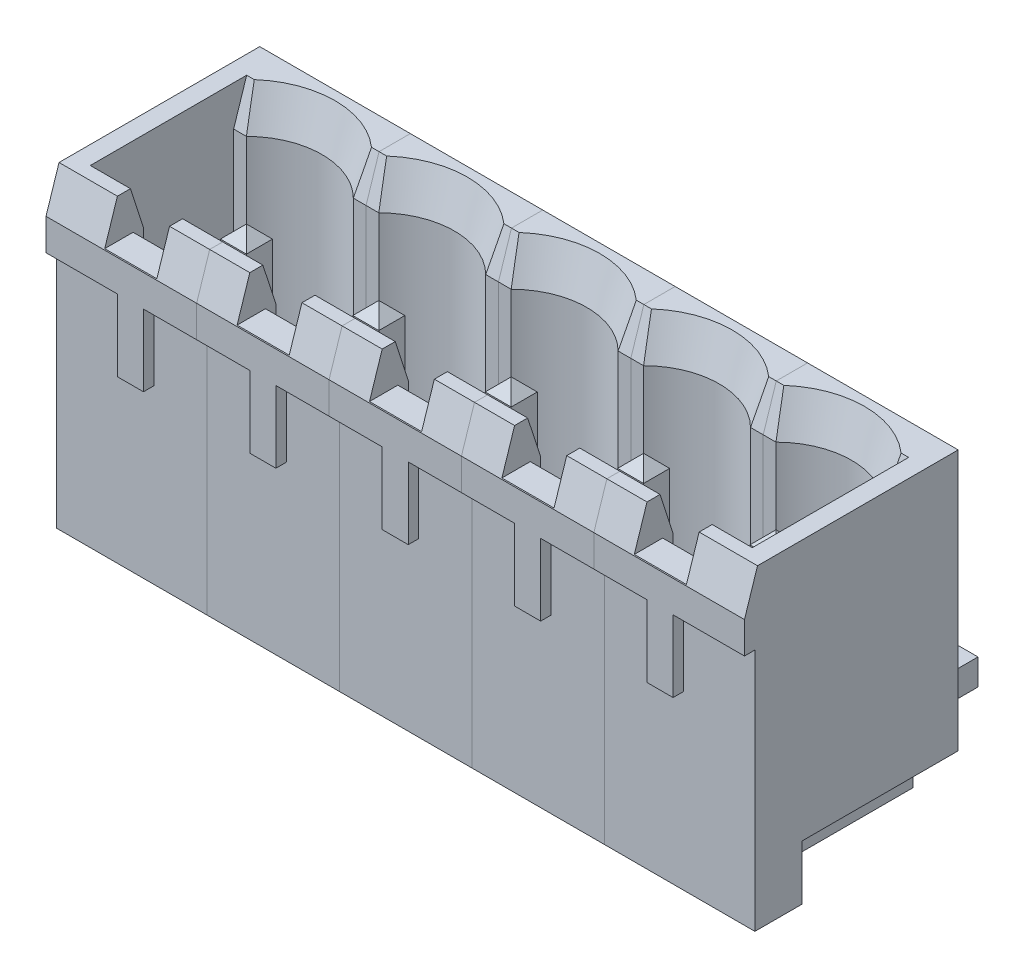
from build123d import *
from OCP.BRepFilletAPI import BRepFilletAPI_MakeChamfer

# Parameters (mm, degrees)
SKETCH_1_W             = 5.08
SKETCH_1_H             = 12.1
EXTRUDE_1_DEPTH        = 8.2
CUT_EXTRUDE_1_DEPTH    = 8.7
SKETCH_3_R             = 1.2
EXTRUDE_2_DEPTH        = 2
FILLET_1_R             = 0.25
CHAMFER_1_SIZE         = 0.5
CHAMFER_1_SIZE2        = 1.538841769
SKETCH_4_W             = 2
SKETCH_4_H             = 1.010953213
CUT_EXTRUDE_2_DEPTH    = 4.75
SKETCH_5_W             = 2
SKETCH_5_H             = 1.705458635
CUT_EXTRUDE_3_DEPTH    = 1.5
CHAMFER_2_SIZE         = 0.5
CHAMFER_2_SIZE2        = 1.538841769
SKETCH_6_W             = 5.08
SKETCH_6_H             = 6.6
CUT_EXTRUDE_4_DEPTH    = 0.4
SKETCH_7_W             = 2.04
SKETCH_7_H             = 2.75
CUT_EXTRUDE_5_DEPTH    = 0.4
EXTRUDE_1_2_DEPTH      = 0.5
EXTRUDE_1_2_DEPTH_BACK = 0.5
CHAMFER_3_SIZE         = 0.5
SKETCH_9_W             = 1
SKETCH_9_H             = 2.1
SKETCH_9_W_2           = 1.04
CUT_EXTRUDE_6_DEPTH    = 6
PATTERN_LINEAR_1_COUNT = 5
PATTERN_LINEAR_1_PITCH = 5.08
MOVE_BODY_1_ANGLE      = 180
EXTRUDE_3_DEPTH        = 0.7
EXTRUDE_4_DEPTH        = 0.7


with BuildPart() as part:
    # Эскиз1 → Extrude 1 (new body)
    with BuildSketch(Plane(origin=(0, 0, 0), x_dir=(1, 0, 0), z_dir=(0, 1, 0))):
        Rectangle(SKETCH_1_W, SKETCH_1_H)
    extrude(amount=EXTRUDE_1_DEPTH)

    # Эскиз2 → Вырез-Вытянуть1 (cut)
    with BuildSketch(Plane.XY.offset(6.05)):
        with BuildLine():
            Line((-2.54, 6.7), (2.54, 6.7))
            Line((2.54, 6.7), (2.54, 1.7))
            Line((2.54, 1.7), (2.05121915, 1.7))
            ThreePointArc((2.05121915, 1.7), (0, 0.85), (-2.05121915, 1.7))
            Line((-2.05121915, 1.7), (-2.54, 1.7))
            Line((-2.54, 1.7), (-2.54, 6.7))
        make_face()
    extrude(amount=-CUT_EXTRUDE_1_DEPTH, mode=Mode.SUBTRACT)

    # Эскиз3 → Бобышка-Вытянуть2 (add)
    with BuildSketch(Plane.XY.offset(-2.65)):
        with Locations((0, 3.75)):
            Circle(SKETCH_3_R)
    extrude(amount=EXTRUDE_2_DEPTH)

    # Скругление1
    fillet_1_edges = [part.edges().sort_by_distance(p)[0] for p in [
        (-1.2, 3.75, -0.65),
    ]]
    fillet(fillet_1_edges, radius=FILLET_1_R)

    # Фаска1: one chamfer whose edges measure the first distance from different faces: ONE call of the kernel's chamfer builder (chamfer() names one face for all edges)
    chamfer_1_edges_1 = [part.edges().sort_by_distance(p)[0] for p in [
        (0, 6.7, 6.05),
    ]]
    chamfer_1_side_1 = [part.faces().sort_by_distance(p)[0] for p in [
        (0, 7.45, 6.05),
    ]]
    chamfer_1_edges_2 = [part.edges().sort_by_distance(p)[0] for p in [
        (2.295609575, 1.7, 6.05),
        (-2.295609575, 1.7, 6.05),
        (0, 0.85, 6.05),
    ]]
    chamfer_1_side_2 = [part.faces().sort_by_distance(p)[0] for p in [
        (0, 0.655214235, 6.05),
    ]]
    chamfer_1 = BRepFilletAPI_MakeChamfer(part.part.solid().wrapped)
    for e in chamfer_1_edges_1:
        chamfer_1.Add(CHAMFER_1_SIZE, CHAMFER_1_SIZE2, e.wrapped, chamfer_1_side_1[0].wrapped)  # the first distance lies on this face
    for e in chamfer_1_edges_2:
        chamfer_1.Add(CHAMFER_1_SIZE, CHAMFER_1_SIZE2, e.wrapped, chamfer_1_side_2[0].wrapped)  # the first distance lies on this face
    add(Compound.cast(chamfer_1.Shape()), mode=Mode.REPLACE)

    # Эскиз4 → Вырез-Вытянуть2 (cut)
    with BuildSketch(Plane.XY.offset(6.05)):
        with Locations((0, 6.594523394)):
            Rectangle(SKETCH_4_W, SKETCH_4_H)
    extrude(amount=-CUT_EXTRUDE_2_DEPTH, mode=Mode.SUBTRACT)

    # Эскиз5 → Вырез-Вытянуть3 (cut)
    with BuildSketch(Plane.XY.offset(6.05)):
        with Locations((0, 7.552729318)):
            Rectangle(SKETCH_5_W, SKETCH_5_H)
    extrude(amount=-CUT_EXTRUDE_3_DEPTH, mode=Mode.SUBTRACT)

    # Фаска2
    chamfer_2_edges = [part.edges().sort_by_distance(p)[0] for p in [
        (-1.77, 8.2, 6.05),
    ]]
    chamfer_2_side = [part.faces().sort_by_distance(p)[0] for p in [
        (-1.77, 7.7, 6.05),
    ]]
    chamfer(chamfer_2_edges, length=CHAMFER_2_SIZE, length2=CHAMFER_2_SIZE2, reference=chamfer_2_side[0])

    # Эскиз6 → Вырез-Вытянуть4 (cut)
    with BuildSketch(Plane(origin=(0, 8.2, 0), x_dir=(1, 0, 0), z_dir=(0, 1, 0))):
        with Locations((0, 2.75)):
            Rectangle(SKETCH_6_W, SKETCH_6_H)
    extrude(amount=-CUT_EXTRUDE_4_DEPTH, mode=Mode.SUBTRACT)

    # Эскиз7 → Вырез-Вытянуть5 (cut)
    with BuildSketch(Plane(origin=(0, 8.2, 0), x_dir=(1, 0, 0), z_dir=(0, 1, 0))):
        with Locations((1.52, -1.925)):
            Rectangle(SKETCH_7_W, SKETCH_7_H)
        with Locations((-1.52, -1.925)):
            Rectangle(SKETCH_7_W, SKETCH_7_H)
    extrude(amount=-CUT_EXTRUDE_5_DEPTH, mode=Mode.SUBTRACT)

    # Эскиз9 → Вырез-Вытянуть6 (cut)
    with BuildSketch(Plane.XZ):
        with Locations((0, -5)):
            Rectangle(SKETCH_9_W, SKETCH_9_H)
        with Locations((-2.02, -5)):
            Rectangle(SKETCH_9_W_2, SKETCH_9_H)
        with Locations((2.02, -5)):
            Rectangle(SKETCH_9_W_2, SKETCH_9_H)
    extrude(amount=-CUT_EXTRUDE_6_DEPTH, mode=Mode.SUBTRACT)


with BuildPart() as body_2:
    # Эскиз8 → Extrude 1 2 (new, two sides: drawn at the far end of the back side and taken through both)
    with BuildSketch(Plane(origin=(0, 0, 0), x_dir=(0, 0, -1), z_dir=(1, 0, 0)).offset(-EXTRUDE_1_2_DEPTH_BACK)):
        with BuildLine():
            Line((-3.65, 3.25), (3.95, 3.25))
            Line((3.95, 3.25), (3.95, -4))
            Line((3.95, -4), (4.95, -4))
            Line((4.95, -4), (4.95, 3.25))
            ThreePointArc((4.95, 3.25), (4.657106781, 3.957106781), (3.95, 4.25))
            Line((3.95, 4.25), (-3.65, 4.25))
            Line((-3.65, 4.25), (-3.65, 3.25))
        make_face()
    extrude(amount=EXTRUDE_1_2_DEPTH + EXTRUDE_1_2_DEPTH_BACK)

    # Фаска3
    chamfer_3_edges = [body_2.edges().sort_by_distance(p)[0] for p in [
        (0, 3.25, 3.65),
        (0, 4.25, 3.65),
        (0, -4, -4.95),
        (0, -4, -3.95),
        (0.5, -4, -4.45),
        (0.5, 3.75, 3.65),
        (-0.5, 3.75, 3.65),
        (-0.5, -4, -4.45),
    ]]
    chamfer(chamfer_3_edges, length=CHAMFER_3_SIZE - 0.0001)  # a hair under: the kernel refuses the full size


with BuildPart() as pattern_linear_1_1:
    # Линейный массив1: pattern copy
    add(part.part.moved(Location(Vector(-1, 0, 0) * (1 * PATTERN_LINEAR_1_PITCH))))


with BuildPart() as pattern_linear_1_2:
    # Линейный массив1: pattern copy
    add(part.part.moved(Location(Vector(-1, 0, 0) * (2 * PATTERN_LINEAR_1_PITCH))))


with BuildPart() as pattern_linear_1_3:
    # Линейный массив1: pattern copy
    add(part.part.moved(Location(Vector(-1, 0, 0) * (3 * PATTERN_LINEAR_1_PITCH))))


with BuildPart() as pattern_linear_1_4:
    # Линейный массив1: pattern copy
    add(part.part.moved(Location(Vector(-1, 0, 0) * (4 * PATTERN_LINEAR_1_PITCH))))


with BuildPart() as pattern_linear_1_5:
    # Линейный массив1: pattern copy
    add(body_2.part.moved(Location(Vector(-1, 0, 0) * (1 * PATTERN_LINEAR_1_PITCH))))


with BuildPart() as pattern_linear_1_6:
    # Линейный массив1: pattern copy
    add(body_2.part.moved(Location(Vector(-1, 0, 0) * (2 * PATTERN_LINEAR_1_PITCH))))


with BuildPart() as pattern_linear_1_7:
    # Линейный массив1: pattern copy
    add(body_2.part.moved(Location(Vector(-1, 0, 0) * (3 * PATTERN_LINEAR_1_PITCH))))


with BuildPart() as pattern_linear_1_8:
    # Линейный массив1: pattern copy
    add(body_2.part.moved(Location(Vector(-1, 0, 0) * (4 * PATTERN_LINEAR_1_PITCH))))


with BuildPart() as body_2_1:
    # Move Body 1: moved
    add(body_2.part.rotate(Axis((0, 0, 0), (0, 0.7071067811865488, 0.7071067811865462)), MOVE_BODY_1_ANGLE))


with BuildPart() as part_1:
    # Move Body 1: moved
    add(part.part.rotate(Axis((0, 0, 0), (0, 0.7071067811865488, 0.7071067811865462)), MOVE_BODY_1_ANGLE))


with BuildPart() as pattern_linear_1_5_1:
    # Move Body 1: moved
    add(pattern_linear_1_5.part.rotate(Axis((0, 0, 0), (0, 0.7071067811865488, 0.7071067811865462)), MOVE_BODY_1_ANGLE))


with BuildPart() as pattern_linear_1_1_1:
    # Move Body 1: moved
    add(pattern_linear_1_1.part.rotate(Axis((0, 0, 0), (0, 0.7071067811865488, 0.7071067811865462)), MOVE_BODY_1_ANGLE))


with BuildPart() as pattern_linear_1_2_1:
    # Move Body 1: moved
    add(pattern_linear_1_2.part.rotate(Axis((0, 0, 0), (0, 0.7071067811865488, 0.7071067811865462)), MOVE_BODY_1_ANGLE))


with BuildPart() as pattern_linear_1_6_1:
    # Move Body 1: moved
    add(pattern_linear_1_6.part.rotate(Axis((0, 0, 0), (0, 0.7071067811865488, 0.7071067811865462)), MOVE_BODY_1_ANGLE))


with BuildPart() as pattern_linear_1_3_1:
    # Move Body 1: moved
    add(pattern_linear_1_3.part.rotate(Axis((0, 0, 0), (0, 0.7071067811865488, 0.7071067811865462)), MOVE_BODY_1_ANGLE))


with BuildPart() as pattern_linear_1_4_1:
    # Move Body 1: moved
    add(pattern_linear_1_4.part.rotate(Axis((0, 0, 0), (0, 0.7071067811865488, 0.7071067811865462)), MOVE_BODY_1_ANGLE))


with BuildPart() as pattern_linear_1_8_1:
    # Move Body 1: moved
    add(pattern_linear_1_8.part.rotate(Axis((0, 0, 0), (0, 0.7071067811865488, 0.7071067811865462)), MOVE_BODY_1_ANGLE))


with BuildPart() as pattern_linear_1_7_1:
    # Move Body 1: moved
    add(pattern_linear_1_7.part.rotate(Axis((0, 0, 0), (0, 0.7071067811865488, 0.7071067811865462)), MOVE_BODY_1_ANGLE))


with BuildPart() as pattern_linear_1_7_2:
    # Move Body 2: read off the stored shape, not the designer's step
    # Move Body 2: moved
    add(pattern_linear_1_7_1.part.moved(Location((0, 4.45, 0))))


with BuildPart() as pattern_linear_1_8_2:
    # Move Body 2 2: moved
    add(pattern_linear_1_8_1.part.moved(Location((0, 4.45, 0))))


with BuildPart() as pattern_linear_1_4_2:
    # Move Body 2 3: moved
    add(pattern_linear_1_4_1.part.moved(Location((0, 4.45, 0))))

    # Эскиз11 → Бобышка-Вытянуть4 (add)
    with BuildSketch(Plane(origin=(22.86, 0, 0), x_dir=(0, 0, -1), z_dir=(1, 0, 0))):
        Polygon((0, 10.5), (-7.7, 10.5), (-8.2, 8.961158231), (-8.2, 7.75), (-7.8, 7.75), (-7.8, -1.6), (-6, -1.6), (-6, 0.5), (0, 0.5), align=None)
    extrude(amount=EXTRUDE_4_DEPTH)


with BuildPart() as pattern_linear_1_3_2:
    # Move Body 2 4: moved
    add(pattern_linear_1_3_1.part.moved(Location((0, 4.45, 0))))


with BuildPart() as pattern_linear_1_6_2:
    # Move Body 2 5: moved
    add(pattern_linear_1_6_1.part.moved(Location((0, 4.45, 0))))


with BuildPart() as pattern_linear_1_2_2:
    # Move Body 2 6: moved
    add(pattern_linear_1_2_1.part.moved(Location((0, 4.45, 0))))


with BuildPart() as pattern_linear_1_1_2:
    # Move Body 2 7: moved
    add(pattern_linear_1_1_1.part.moved(Location((0, 4.45, 0))))


with BuildPart() as pattern_linear_1_5_2:
    # Move Body 2 8: moved
    add(pattern_linear_1_5_1.part.moved(Location((0, 4.45, 0))))


with BuildPart() as part_2:
    # Move Body 2 9: moved
    add(part_1.part.moved(Location((0, 4.45, 0))))

    # Эскиз10 → Бобышка-Вытянуть3 (add)
    with BuildSketch(Plane.ZY.offset(2.54)):
        Polygon((7.7, 10.5), (0, 10.5), (0, 0.5), (6, 0.5), (6, -1.6), (7.8, -1.6), (7.8, 7.75), (8.2, 7.75), (8.2, 8.961158231), align=None)
    extrude(amount=EXTRUDE_3_DEPTH)


with BuildPart() as body_2_2:
    # Move Body 2 10: moved
    add(body_2_1.part.moved(Location((0, 4.45, 0))))


solid = Compound([pattern_linear_1_7_2.part, pattern_linear_1_8_2.part, pattern_linear_1_4_2.part, pattern_linear_1_3_2.part, pattern_linear_1_6_2.part, pattern_linear_1_2_2.part, pattern_linear_1_1_2.part, pattern_linear_1_5_2.part, part_2.part, body_2_2.part])
